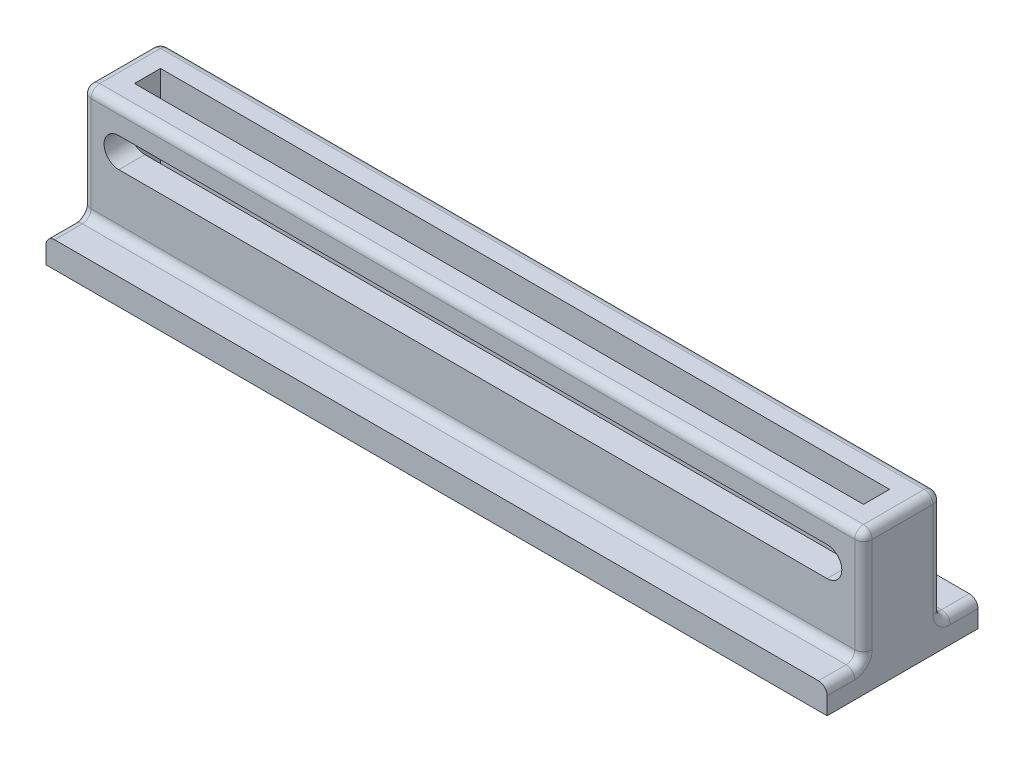
from build123d import *

# Parameters (mm, degrees)
SKETCH2_W           = 90
SKETCH2_H           = 17.38310799
BOSS_EXTRUDE1_DEPTH = 3
SKETCH5_W           = 90
SKETCH5_H           = 9
SKETCH5_W_2         = 84
SKETCH5_H_2         = 3
BOSS_EXTRUDE2_DEPTH = 13
SKETCH6_W           = 85
SKETCH6_H           = 3.4
CUT_EXTRUDE1_DEPTH  = 50.548129095
FILLET1_R           = 1.5
FILLET4_R           = 1.7
FILLET5_R           = 1.7
FILLET8_R           = 1


# Some blends are built 0.0001 mm under size
with BuildPart() as part:
    # Sketch2 → Boss-Extrude1 (new body)
    with BuildSketch(Plane(origin=(0, 0, 0), x_dir=(1, 0, 0), z_dir=(0, 1, 0))):
        Rectangle(SKETCH2_W, SKETCH2_H)
    extrude(amount=BOSS_EXTRUDE1_DEPTH)

    # Sketch5 → Boss-Extrude2 (add)
    with BuildSketch(Plane(origin=(0, 3, 0), x_dir=(1, 0, 0), z_dir=(0, 1, 0))):
        Rectangle(SKETCH5_W, SKETCH5_H)
        Rectangle(SKETCH5_W_2, SKETCH5_H_2, mode=Mode.SUBTRACT)
    extrude(amount=BOSS_EXTRUDE2_DEPTH)

    # Sketch6 → Cut-Extrude1 (cut, through all)
    with BuildSketch(Plane(origin=(0, 0, -4.5), x_dir=(-1, 0, 0), z_dir=(0, 0, -1))):
        with Locations((0, 11.2)):
            Rectangle(SKETCH6_W, SKETCH6_H)
    extrude(amount=-CUT_EXTRUDE1_DEPTH, mode=Mode.SUBTRACT)

    # Fillet1
    fillet1_edges = [part.edges().sort_by_distance(p)[0] for p in [
        (0, 3, -1.5),
        (0, 3, 1.5),
    ]]
    fillet(fillet1_edges, radius=FILLET1_R - 0.0001)  # a hair under: the kernel refuses the full size

    # Fillet4
    # the kernel refuses this fillet: 1.7 mm, written as the material it adds along each edge
    with BuildSketch(Plane(origin=(42.5, 9.5, -4.5), x_dir=(-1, 0, 0), z_dir=(0, 0, 1))) as fillet4_piece_1_section:
        with BuildLine():
            CenterArc((FILLET4_R, -FILLET4_R), FILLET4_R, 90, 90)
            Line((0, -FILLET4_R), (0, 0))
            Line((0, 0), (FILLET4_R, 0))
        make_face()
    fillet4_piece_1 = extrude(amount=9, mode=Mode.PRIVATE)
    fillet4_piece_1 = split(fillet4_piece_1, bisect_by=Plane(origin=(41.653565017, 9.615018658, -1.5), z_dir=(0, 0, -1)), keep=Keep.TOP, mode=Mode.PRIVATE)
    fillet4_piece_1 = split(fillet4_piece_1, bisect_by=Plane(origin=(42, 9.615018658, -3), z_dir=(-1, 0, 0)), keep=Keep.TOP, mode=Mode.PRIVATE)
    add(fillet4_piece_1)
    with BuildSketch(Plane(origin=(42.5, 9.5, -4.5), x_dir=(-1, 0, 0), z_dir=(0, 0, 1))) as fillet4_piece_2_section:
        with BuildLine():
            CenterArc((FILLET4_R, -FILLET4_R), FILLET4_R, 90, 90)
            Line((0, -FILLET4_R), (0, 0))
            Line((0, 0), (FILLET4_R, 0))
        make_face()
    fillet4_piece_2 = extrude(amount=9, mode=Mode.PRIVATE)
    fillet4_piece_2 = split(fillet4_piece_2, bisect_by=Plane(origin=(42.31915671, 10.004156927, -1.5), z_dir=(0, 0, -1)), keep=Keep.TOP, mode=Mode.PRIVATE)
    fillet4_piece_2 = split(fillet4_piece_2, bisect_by=Plane(origin=(42, 10.004156927, -3), z_dir=(1, 0, 0)), keep=Keep.TOP, mode=Mode.PRIVATE)
    add(fillet4_piece_2)
    with BuildSketch(Plane(origin=(42.5, 9.5, -4.5), x_dir=(-1, 0, 0), z_dir=(0, 0, 1))) as fillet4_piece_3_section:
        with BuildLine():
            CenterArc((FILLET4_R, -FILLET4_R), FILLET4_R, 90, 90)
            Line((0, -FILLET4_R), (0, 0))
            Line((0, 0), (FILLET4_R, 0))
        make_face()
    fillet4_piece_3 = extrude(amount=9, mode=Mode.PRIVATE)
    fillet4_piece_3 = split(fillet4_piece_3, bisect_by=Plane(origin=(42.31915671, 10.004156927, -1.5), z_dir=(0, 0, 1)), keep=Keep.TOP, mode=Mode.PRIVATE)
    fillet4_piece_3 = split(fillet4_piece_3, bisect_by=Plane(origin=(42.31915671, 10.004156927, 1.5), z_dir=(0, 0, -1)), keep=Keep.TOP, mode=Mode.PRIVATE)
    fillet4_piece_3 = split(fillet4_piece_3, bisect_by=Plane(origin=(42, 10.004156927, 0), z_dir=(1, 0, 0)), keep=Keep.TOP, mode=Mode.PRIVATE)
    add(fillet4_piece_3)
    with BuildSketch(Plane(origin=(42.5, 9.5, -4.5), x_dir=(-1, 0, 0), z_dir=(0, 0, 1))) as fillet4_piece_4_section:
        with BuildLine():
            CenterArc((FILLET4_R, -FILLET4_R), FILLET4_R, 90, 90)
            Line((0, -FILLET4_R), (0, 0))
            Line((0, 0), (FILLET4_R, 0))
        make_face()
    fillet4_piece_4 = extrude(amount=9, mode=Mode.PRIVATE)
    fillet4_piece_4 = split(fillet4_piece_4, bisect_by=Plane(origin=(41.653565017, 9.615018658, 1.5), z_dir=(0, 0, 1)), keep=Keep.TOP, mode=Mode.PRIVATE)
    fillet4_piece_4 = split(fillet4_piece_4, bisect_by=Plane(origin=(42, 9.615018658, 3), z_dir=(-1, 0, 0)), keep=Keep.TOP, mode=Mode.PRIVATE)
    add(fillet4_piece_4)
    with BuildSketch(Plane(origin=(42.5, 9.5, -4.5), x_dir=(-1, 0, 0), z_dir=(0, 0, 1))) as fillet4_piece_5_section:
        with BuildLine():
            CenterArc((FILLET4_R, -FILLET4_R), FILLET4_R, 90, 90)
            Line((0, -FILLET4_R), (0, 0))
            Line((0, 0), (FILLET4_R, 0))
        make_face()
    fillet4_piece_5 = extrude(amount=9, mode=Mode.PRIVATE)
    fillet4_piece_5 = split(fillet4_piece_5, bisect_by=Plane(origin=(42.31915671, 10.004156927, 1.5), z_dir=(0, 0, 1)), keep=Keep.TOP, mode=Mode.PRIVATE)
    fillet4_piece_5 = split(fillet4_piece_5, bisect_by=Plane(origin=(42, 10.004156927, 3), z_dir=(1, 0, 0)), keep=Keep.TOP, mode=Mode.PRIVATE)
    add(fillet4_piece_5)
    with BuildSketch(Plane(origin=(42.5, 12.9, -4.5), x_dir=(0, -1, 0), z_dir=(0, 0, 1))) as fillet4_piece_6_section:
        with BuildLine():
            CenterArc((FILLET4_R, -FILLET4_R), FILLET4_R, 90, 90)
            Line((0, -FILLET4_R), (0, 0))
            Line((0, 0), (FILLET4_R, 0))
        make_face()
    fillet4_piece_6 = extrude(amount=9, mode=Mode.PRIVATE)
    fillet4_piece_6 = split(fillet4_piece_6, bisect_by=Plane(origin=(42.31915671, 12.395843073, -1.5), z_dir=(0, 0, -1)), keep=Keep.TOP, mode=Mode.PRIVATE)
    fillet4_piece_6 = split(fillet4_piece_6, bisect_by=Plane(origin=(42, 12.395843073, -3), z_dir=(1, 0, 0)), keep=Keep.TOP, mode=Mode.PRIVATE)
    add(fillet4_piece_6)
    with BuildSketch(Plane(origin=(42.5, 12.9, -4.5), x_dir=(0, -1, 0), z_dir=(0, 0, 1))) as fillet4_piece_7_section:
        with BuildLine():
            CenterArc((FILLET4_R, -FILLET4_R), FILLET4_R, 90, 90)
            Line((0, -FILLET4_R), (0, 0))
            Line((0, 0), (FILLET4_R, 0))
        make_face()
    fillet4_piece_7 = extrude(amount=9, mode=Mode.PRIVATE)
    fillet4_piece_7 = split(fillet4_piece_7, bisect_by=Plane(origin=(41.653565017, 12.784981342, -1.5), z_dir=(0, 0, -1)), keep=Keep.TOP, mode=Mode.PRIVATE)
    fillet4_piece_7 = split(fillet4_piece_7, bisect_by=Plane(origin=(42, 12.784981342, -3), z_dir=(-1, 0, 0)), keep=Keep.TOP, mode=Mode.PRIVATE)
    add(fillet4_piece_7)
    with BuildSketch(Plane(origin=(42.5, 12.9, -4.5), x_dir=(0, -1, 0), z_dir=(0, 0, 1))) as fillet4_piece_8_section:
        with BuildLine():
            CenterArc((FILLET4_R, -FILLET4_R), FILLET4_R, 90, 90)
            Line((0, -FILLET4_R), (0, 0))
            Line((0, 0), (FILLET4_R, 0))
        make_face()
    fillet4_piece_8 = extrude(amount=9, mode=Mode.PRIVATE)
    fillet4_piece_8 = split(fillet4_piece_8, bisect_by=Plane(origin=(42.31915671, 12.395843073, -1.5), z_dir=(0, 0, 1)), keep=Keep.TOP, mode=Mode.PRIVATE)
    fillet4_piece_8 = split(fillet4_piece_8, bisect_by=Plane(origin=(42, 12.395843073, 0), z_dir=(1, 0, 0)), keep=Keep.TOP, mode=Mode.PRIVATE)
    fillet4_piece_8 = split(fillet4_piece_8, bisect_by=Plane(origin=(42.31915671, 12.395843073, 1.5), z_dir=(0, 0, -1)), keep=Keep.TOP, mode=Mode.PRIVATE)
    add(fillet4_piece_8)
    with BuildSketch(Plane(origin=(42.5, 12.9, -4.5), x_dir=(0, -1, 0), z_dir=(0, 0, 1))) as fillet4_piece_9_section:
        with BuildLine():
            CenterArc((FILLET4_R, -FILLET4_R), FILLET4_R, 90, 90)
            Line((0, -FILLET4_R), (0, 0))
            Line((0, 0), (FILLET4_R, 0))
        make_face()
    fillet4_piece_9 = extrude(amount=9, mode=Mode.PRIVATE)
    fillet4_piece_9 = split(fillet4_piece_9, bisect_by=Plane(origin=(42, 12.395843073, 3), z_dir=(1, 0, 0)), keep=Keep.TOP, mode=Mode.PRIVATE)
    fillet4_piece_9 = split(fillet4_piece_9, bisect_by=Plane(origin=(42.31915671, 12.395843073, 1.5), z_dir=(0, 0, 1)), keep=Keep.TOP, mode=Mode.PRIVATE)
    add(fillet4_piece_9)
    with BuildSketch(Plane(origin=(42.5, 12.9, -4.5), x_dir=(0, -1, 0), z_dir=(0, 0, 1))) as fillet4_piece_10_section:
        with BuildLine():
            CenterArc((FILLET4_R, -FILLET4_R), FILLET4_R, 90, 90)
            Line((0, -FILLET4_R), (0, 0))
            Line((0, 0), (FILLET4_R, 0))
        make_face()
    fillet4_piece_10 = extrude(amount=9, mode=Mode.PRIVATE)
    fillet4_piece_10 = split(fillet4_piece_10, bisect_by=Plane(origin=(42, 12.784981342, 3), z_dir=(-1, 0, 0)), keep=Keep.TOP, mode=Mode.PRIVATE)
    fillet4_piece_10 = split(fillet4_piece_10, bisect_by=Plane(origin=(41.653565017, 12.784981342, 1.5), z_dir=(0, 0, 1)), keep=Keep.TOP, mode=Mode.PRIVATE)
    add(fillet4_piece_10)

    # Fillet5
    # the kernel refuses this fillet: 1.7 mm, written as the material it adds along each edge
    with BuildSketch(Plane(origin=(-42.5, 12.9, -4.5), x_dir=(0, -1, 0), z_dir=(0, 0, 1))) as fillet5_piece_1_section:
        with BuildLine():
            CenterArc((FILLET5_R, FILLET5_R), FILLET5_R, 180, 90)
            Line((0, FILLET5_R), (0, 0))
            Line((0, 0), (FILLET5_R, 0))
        make_face()
    fillet5_piece_1 = extrude(amount=9, mode=Mode.PRIVATE)
    fillet5_piece_1 = split(fillet5_piece_1, bisect_by=Plane(origin=(-42, 12.395843073, -3), z_dir=(-1, 0, 0)), keep=Keep.TOP, mode=Mode.PRIVATE)
    fillet5_piece_1 = split(fillet5_piece_1, bisect_by=Plane(origin=(-42.31915671, 12.395843073, -1.5), z_dir=(0, 0, -1)), keep=Keep.TOP, mode=Mode.PRIVATE)
    add(fillet5_piece_1)
    with BuildSketch(Plane(origin=(-42.5, 12.9, -4.5), x_dir=(0, -1, 0), z_dir=(0, 0, 1))) as fillet5_piece_2_section:
        with BuildLine():
            CenterArc((FILLET5_R, FILLET5_R), FILLET5_R, 180, 90)
            Line((0, FILLET5_R), (0, 0))
            Line((0, 0), (FILLET5_R, 0))
        make_face()
    fillet5_piece_2 = extrude(amount=9, mode=Mode.PRIVATE)
    fillet5_piece_2 = split(fillet5_piece_2, bisect_by=Plane(origin=(-42, 12.784981342, -3), z_dir=(1, 0, 0)), keep=Keep.TOP, mode=Mode.PRIVATE)
    fillet5_piece_2 = split(fillet5_piece_2, bisect_by=Plane(origin=(-41.653565017, 12.784981342, -1.5), z_dir=(0, 0, -1)), keep=Keep.TOP, mode=Mode.PRIVATE)
    add(fillet5_piece_2)
    with BuildSketch(Plane(origin=(-42.5, 12.9, -4.5), x_dir=(0, -1, 0), z_dir=(0, 0, 1))) as fillet5_piece_3_section:
        with BuildLine():
            CenterArc((FILLET5_R, FILLET5_R), FILLET5_R, 180, 90)
            Line((0, FILLET5_R), (0, 0))
            Line((0, 0), (FILLET5_R, 0))
        make_face()
    fillet5_piece_3 = extrude(amount=9, mode=Mode.PRIVATE)
    fillet5_piece_3 = split(fillet5_piece_3, bisect_by=Plane(origin=(-42, 12.395843073, 0), z_dir=(-1, 0, 0)), keep=Keep.TOP, mode=Mode.PRIVATE)
    fillet5_piece_3 = split(fillet5_piece_3, bisect_by=Plane(origin=(-42.31915671, 12.395843073, 1.5), z_dir=(0, 0, -1)), keep=Keep.TOP, mode=Mode.PRIVATE)
    fillet5_piece_3 = split(fillet5_piece_3, bisect_by=Plane(origin=(-42.31915671, 12.395843073, -1.5), z_dir=(0, 0, 1)), keep=Keep.TOP, mode=Mode.PRIVATE)
    add(fillet5_piece_3)
    with BuildSketch(Plane(origin=(-42.5, 12.9, -4.5), x_dir=(0, -1, 0), z_dir=(0, 0, 1))) as fillet5_piece_4_section:
        with BuildLine():
            CenterArc((FILLET5_R, FILLET5_R), FILLET5_R, 180, 90)
            Line((0, FILLET5_R), (0, 0))
            Line((0, 0), (FILLET5_R, 0))
        make_face()
    fillet5_piece_4 = extrude(amount=9, mode=Mode.PRIVATE)
    fillet5_piece_4 = split(fillet5_piece_4, bisect_by=Plane(origin=(-42, 12.395843073, 3), z_dir=(-1, 0, 0)), keep=Keep.TOP, mode=Mode.PRIVATE)
    fillet5_piece_4 = split(fillet5_piece_4, bisect_by=Plane(origin=(-42.31915671, 12.395843073, 1.5), z_dir=(0, 0, 1)), keep=Keep.TOP, mode=Mode.PRIVATE)
    add(fillet5_piece_4)
    with BuildSketch(Plane(origin=(-42.5, 12.9, -4.5), x_dir=(0, -1, 0), z_dir=(0, 0, 1))) as fillet5_piece_5_section:
        with BuildLine():
            CenterArc((FILLET5_R, FILLET5_R), FILLET5_R, 180, 90)
            Line((0, FILLET5_R), (0, 0))
            Line((0, 0), (FILLET5_R, 0))
        make_face()
    fillet5_piece_5 = extrude(amount=9, mode=Mode.PRIVATE)
    fillet5_piece_5 = split(fillet5_piece_5, bisect_by=Plane(origin=(-42, 12.784981342, 3), z_dir=(1, 0, 0)), keep=Keep.TOP, mode=Mode.PRIVATE)
    fillet5_piece_5 = split(fillet5_piece_5, bisect_by=Plane(origin=(-41.653565017, 12.784981342, 1.5), z_dir=(0, 0, 1)), keep=Keep.TOP, mode=Mode.PRIVATE)
    add(fillet5_piece_5)
    with BuildSketch(Plane(origin=(-42.5, 9.5, -4.5), x_dir=(0, 1, 0), z_dir=(0, 0, 1))) as fillet5_piece_6_section:
        with BuildLine():
            CenterArc((FILLET5_R, -FILLET5_R), FILLET5_R, 90, 90)
            Line((0, -FILLET5_R), (0, 0))
            Line((0, 0), (FILLET5_R, 0))
        make_face()
    fillet5_piece_6 = extrude(amount=9, mode=Mode.PRIVATE)
    fillet5_piece_6 = split(fillet5_piece_6, bisect_by=Plane(origin=(-42, 10.004156927, -3), z_dir=(-1, 0, 0)), keep=Keep.TOP, mode=Mode.PRIVATE)
    fillet5_piece_6 = split(fillet5_piece_6, bisect_by=Plane(origin=(-42.31915671, 10.004156927, -1.5), z_dir=(0, 0, -1)), keep=Keep.TOP, mode=Mode.PRIVATE)
    add(fillet5_piece_6)
    with BuildSketch(Plane(origin=(-42.5, 9.5, -4.5), x_dir=(0, 1, 0), z_dir=(0, 0, 1))) as fillet5_piece_7_section:
        with BuildLine():
            CenterArc((FILLET5_R, -FILLET5_R), FILLET5_R, 90, 90)
            Line((0, -FILLET5_R), (0, 0))
            Line((0, 0), (FILLET5_R, 0))
        make_face()
    fillet5_piece_7 = extrude(amount=9, mode=Mode.PRIVATE)
    fillet5_piece_7 = split(fillet5_piece_7, bisect_by=Plane(origin=(-42, 9.615018658, -3), z_dir=(1, 0, 0)), keep=Keep.TOP, mode=Mode.PRIVATE)
    fillet5_piece_7 = split(fillet5_piece_7, bisect_by=Plane(origin=(-41.653565017, 9.615018658, -1.5), z_dir=(0, 0, -1)), keep=Keep.TOP, mode=Mode.PRIVATE)
    add(fillet5_piece_7)
    with BuildSketch(Plane(origin=(-42.5, 9.5, -4.5), x_dir=(0, 1, 0), z_dir=(0, 0, 1))) as fillet5_piece_8_section:
        with BuildLine():
            CenterArc((FILLET5_R, -FILLET5_R), FILLET5_R, 90, 90)
            Line((0, -FILLET5_R), (0, 0))
            Line((0, 0), (FILLET5_R, 0))
        make_face()
    fillet5_piece_8 = extrude(amount=9, mode=Mode.PRIVATE)
    fillet5_piece_8 = split(fillet5_piece_8, bisect_by=Plane(origin=(-42.31915671, 10.004156927, 1.5), z_dir=(0, 0, -1)), keep=Keep.TOP, mode=Mode.PRIVATE)
    fillet5_piece_8 = split(fillet5_piece_8, bisect_by=Plane(origin=(-42, 10.004156927, 0), z_dir=(-1, 0, 0)), keep=Keep.TOP, mode=Mode.PRIVATE)
    fillet5_piece_8 = split(fillet5_piece_8, bisect_by=Plane(origin=(-42.31915671, 10.004156927, -1.5), z_dir=(0, 0, 1)), keep=Keep.TOP, mode=Mode.PRIVATE)
    add(fillet5_piece_8)
    with BuildSketch(Plane(origin=(-42.5, 9.5, -4.5), x_dir=(0, 1, 0), z_dir=(0, 0, 1))) as fillet5_piece_9_section:
        with BuildLine():
            CenterArc((FILLET5_R, -FILLET5_R), FILLET5_R, 90, 90)
            Line((0, -FILLET5_R), (0, 0))
            Line((0, 0), (FILLET5_R, 0))
        make_face()
    fillet5_piece_9 = extrude(amount=9, mode=Mode.PRIVATE)
    fillet5_piece_9 = split(fillet5_piece_9, bisect_by=Plane(origin=(-42.31915671, 10.004156927, 1.5), z_dir=(0, 0, 1)), keep=Keep.TOP, mode=Mode.PRIVATE)
    fillet5_piece_9 = split(fillet5_piece_9, bisect_by=Plane(origin=(-42, 10.004156927, 3), z_dir=(-1, 0, 0)), keep=Keep.TOP, mode=Mode.PRIVATE)
    add(fillet5_piece_9)
    with BuildSketch(Plane(origin=(-42.5, 9.5, -4.5), x_dir=(0, 1, 0), z_dir=(0, 0, 1))) as fillet5_piece_10_section:
        with BuildLine():
            CenterArc((FILLET5_R, -FILLET5_R), FILLET5_R, 90, 90)
            Line((0, -FILLET5_R), (0, 0))
            Line((0, 0), (FILLET5_R, 0))
        make_face()
    fillet5_piece_10 = extrude(amount=9, mode=Mode.PRIVATE)
    fillet5_piece_10 = split(fillet5_piece_10, bisect_by=Plane(origin=(-41.653565017, 9.615018658, 1.5), z_dir=(0, 0, 1)), keep=Keep.TOP, mode=Mode.PRIVATE)
    fillet5_piece_10 = split(fillet5_piece_10, bisect_by=Plane(origin=(-42, 9.615018658, 3), z_dir=(1, 0, 0)), keep=Keep.TOP, mode=Mode.PRIVATE)
    add(fillet5_piece_10)

    # Fillet8
    fillet8_edges = [part.edges().sort_by_distance(p)[0] for p in [
        (-45, 3, -6.595776997),
        (45, 3, -6.595776997),
        (-45, 3, 6.595776997),
        (45, 16, 0),
        (0, 16, -4.5),
        (-45, 16, 0),
        (0, 16, 4.5),
        (45, 9.5, 4.5),
        (0, 3, -4.5),
        (45, 9.5, -4.5),
        (-45, 9.5, -4.5),
        (0, 3, 4.5),
        (-45, 9.5, 4.5),
        (45, 3, 6.595776997),
    ]]
    fillet(fillet8_edges, radius=FILLET8_R)


solid = part.part
